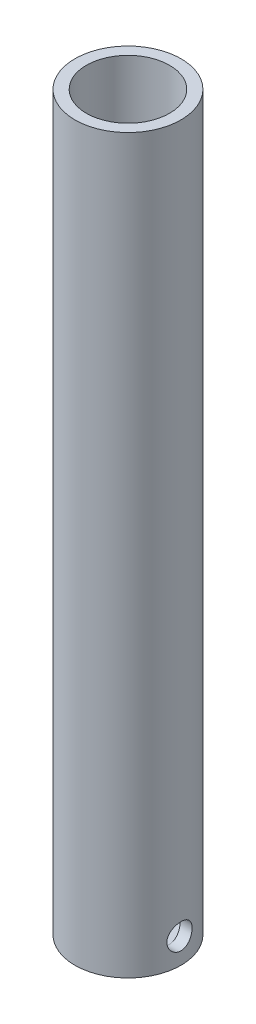
from build123d import *

# Parameters (mm, degrees)
SKETCH1_R           = 13.335
SKETCH1_R_2         = 10.4648
BOSS_EXTRUDE1_DEPTH = 184.15
SKETCH1_2_R         = 10.4648
BOSS_EXTRUDE2_DEPTH = 3.175
SKETCH3_R           = 3.175
CUT_EXTRUDE1_DEPTH  = 14.351


with BuildPart() as part:
    # Sketch1 → Boss-Extrude1 (new body)
    with BuildSketch(Plane(origin=(0, 0, 0), x_dir=(1, 0, 0), z_dir=(0, 1, 0))):
        Circle(SKETCH1_R)
        Circle(SKETCH1_R_2, mode=Mode.SUBTRACT)
    extrude(amount=BOSS_EXTRUDE1_DEPTH)

    # Sketch1<2> → Boss-Extrude2 (add)
    with BuildSketch(Plane(origin=(0, 0, 0), x_dir=(1, 0, 0), z_dir=(0, 1, 0))):
        Circle(SKETCH1_2_R)
    extrude(amount=BOSS_EXTRUDE2_DEPTH)

    # Sketch3 → Cut-Extrude1 (cut)
    with BuildSketch(Plane(origin=(13.335, 0, 0), x_dir=(0, 0, -1), z_dir=(1, 0, 0))):
        with Locations((0, 6.35)):
            Circle(SKETCH3_R)
    extrude(amount=-CUT_EXTRUDE1_DEPTH, mode=Mode.SUBTRACT)


solid = part.part
